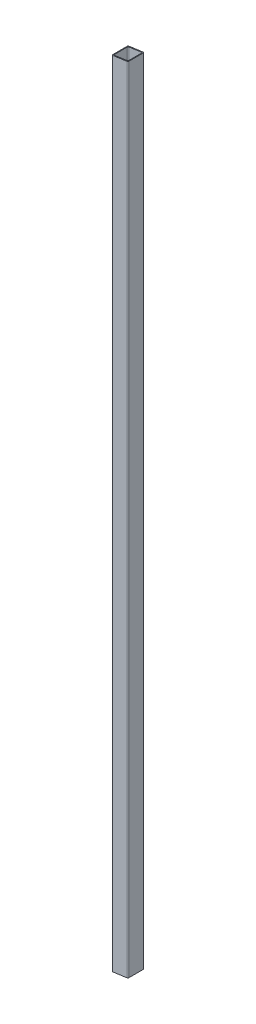
from build123d import *

# Parameters (mm, degrees)
BOSS_EXTRUDE1_DEPTH = 4950
CUT_EXTRUDE1_DEPTH  = 1000


with BuildPart() as part:
    # Sketch1 → Boss-Extrude1 (new body)
    with BuildSketch(Plane(origin=(0, 0, 0), x_dir=(1, 0, 0), z_dir=(0, 1, 0))):
        with BuildLine():
            Line((5, 0), (95, 0))
            ThreePointArc((95, 0), (98.535533906, -1.464466094), (100, -5))
            Line((100, -5), (100, -95))
            ThreePointArc((100, -95), (98.535533906, -98.535533906), (95, -100))
            Line((95, -100), (5, -100))
            ThreePointArc((5, -100), (1.464466094, -98.535533906), (0, -95))
            Line((0, -95), (0, -5))
            ThreePointArc((0, -5), (1.464466094, -1.464466094), (5, 0))
        make_face()
        with BuildLine():
            Line((10, -5), (90, -5))
            ThreePointArc((90, -5), (93.535533906, -6.464466094), (95, -10))
            Line((95, -10), (95, -90))
            ThreePointArc((95, -90), (93.535533906, -93.535533906), (90, -95))
            Line((90, -95), (10, -95))
            ThreePointArc((10, -95), (6.464466094, -93.535533906), (5, -90))
            Line((5, -90), (5, -10))
            ThreePointArc((5, -10), (6.464466094, -6.464466094), (10, -5))
        make_face(mode=Mode.SUBTRACT)
    extrude(amount=BOSS_EXTRUDE1_DEPTH)

    # Sketch2 → Cut-Extrude1 (cut)
    with BuildSketch(Plane(origin=(0, 0, 0), x_dir=(-1, 0, 0), z_dir=(0, 0, -1))):
        Polygon((-100, 14.05408347), (-100, 0), (0, 0), align=None)
        Polygon((-100, 4950), (0, 4935.94591653), (0, 4950), align=None)
    extrude(amount=-CUT_EXTRUDE1_DEPTH, mode=Mode.SUBTRACT)


solid = part.part
